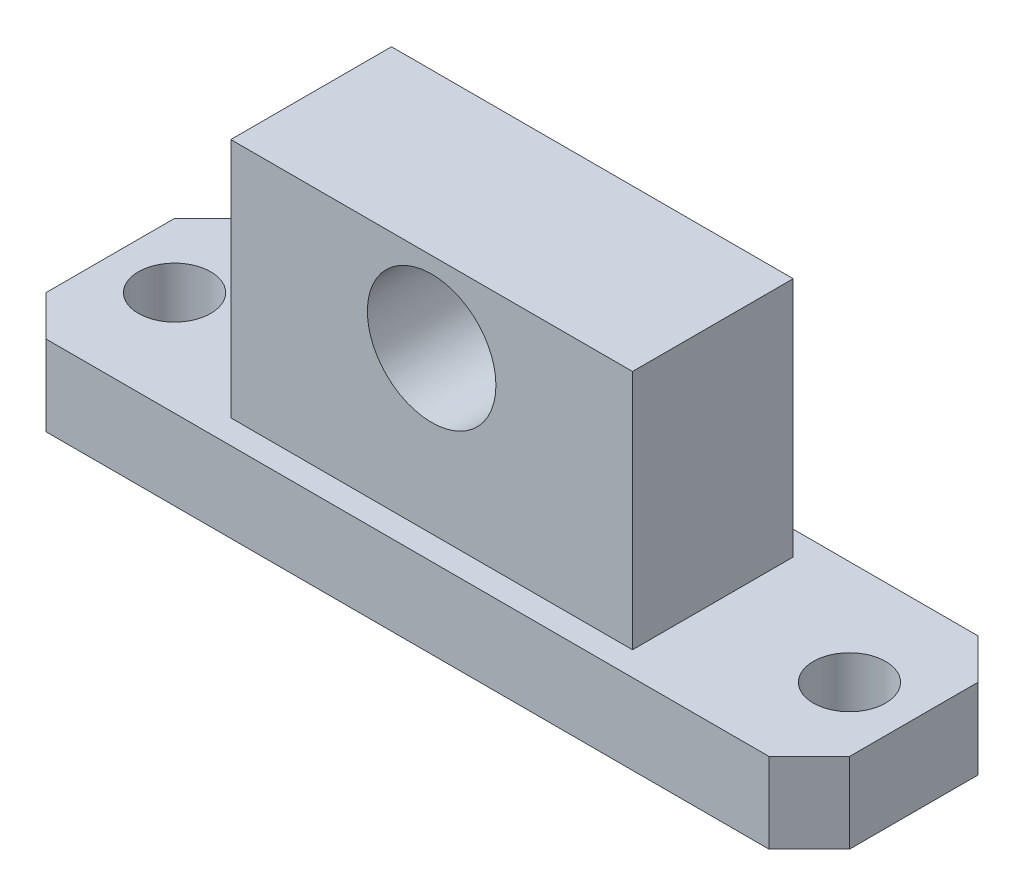
from build123d import *

# Parameters (mm, degrees)
SKETCH1_W           = 50
SKETCH1_H           = 13
BOSS_EXTRUDE1_DEPTH = 5
SKETCH2_R           = 2.25
CUT_EXTRUDE1_DEPTH  = 5
SKETCH3_W           = 25
SKETCH3_H           = 10
BOSS_EXTRUDE2_DEPTH = 15
SKETCH4_R           = 4
CUT_EXTRUDE2_DEPTH  = 15
CHAMFER1_SIZE       = 2.5


with BuildPart() as part:
    # Sketch1 → Boss-Extrude1 (new body)
    with BuildSketch(Plane(origin=(0, 0, 0), x_dir=(1, 0, 0), z_dir=(0, 1, 0))):
        Rectangle(SKETCH1_W, SKETCH1_H)
    extrude(amount=BOSS_EXTRUDE1_DEPTH)

    # Sketch2 → Cut-Extrude1 (cut)
    with BuildSketch(Plane(origin=(0, 5, 0), x_dir=(1, 0, 0), z_dir=(0, 1, 0))):
        with Locations((-21, 0)):
            Circle(SKETCH2_R)
        with Locations((21, 0)):
            Circle(SKETCH2_R)
    extrude(amount=-CUT_EXTRUDE1_DEPTH, mode=Mode.SUBTRACT)

    # Sketch3 → Boss-Extrude2 (add)
    with BuildSketch(Plane(origin=(0, 5, 0), x_dir=(1, 0, 0), z_dir=(0, 1, 0))):
        Rectangle(SKETCH3_W, SKETCH3_H)
    extrude(amount=BOSS_EXTRUDE2_DEPTH)

    # Sketch4 → Cut-Extrude2 (cut)
    with BuildSketch(Plane.XY.offset(5)):
        with Locations((0, 15)):
            Circle(SKETCH4_R)
    extrude(amount=-CUT_EXTRUDE2_DEPTH, mode=Mode.SUBTRACT)

    # Chamfer1
    chamfer1_edges = [part.edges().sort_by_distance(p)[0] for p in [
        (25, 2.5, 6.5),
        (25, 2.5, -6.5),
        (-25, 2.5, 6.5),
        (-25, 2.5, -6.5),
    ]]
    chamfer(chamfer1_edges, length=CHAMFER1_SIZE)


solid = part.part
